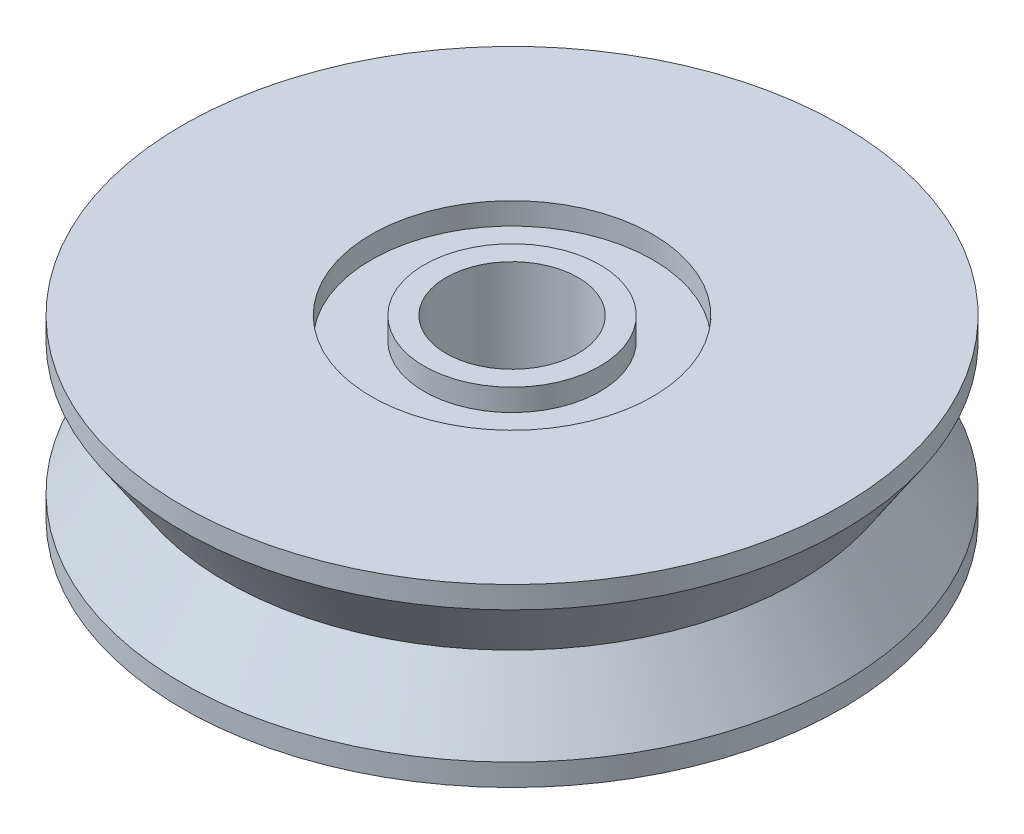
from build123d import *


with BuildPart() as part:
    # Sketch1 → Revolve1 (revolve)
    with BuildSketch(Plane.XY):
        Polygon((-1.5, 0), (-1.5, 2), (-2, 2), (-2, 1.5), (-3.2, 1.5), (-3.2, 2), (-7.5, 2), (-7.5, 1.5), (-6.5, 0), align=None)
    revolve1 = revolve(axis=Axis((0, 0, 0), (0, 1, 0)))

    # Mirror1: Revolve1 across plane
    add(revolve1.mirror(Plane(origin=(-6.5, 0, 0), x_dir=(0, 0, 1), z_dir=(0, 1, 0))))


solid = part.part
